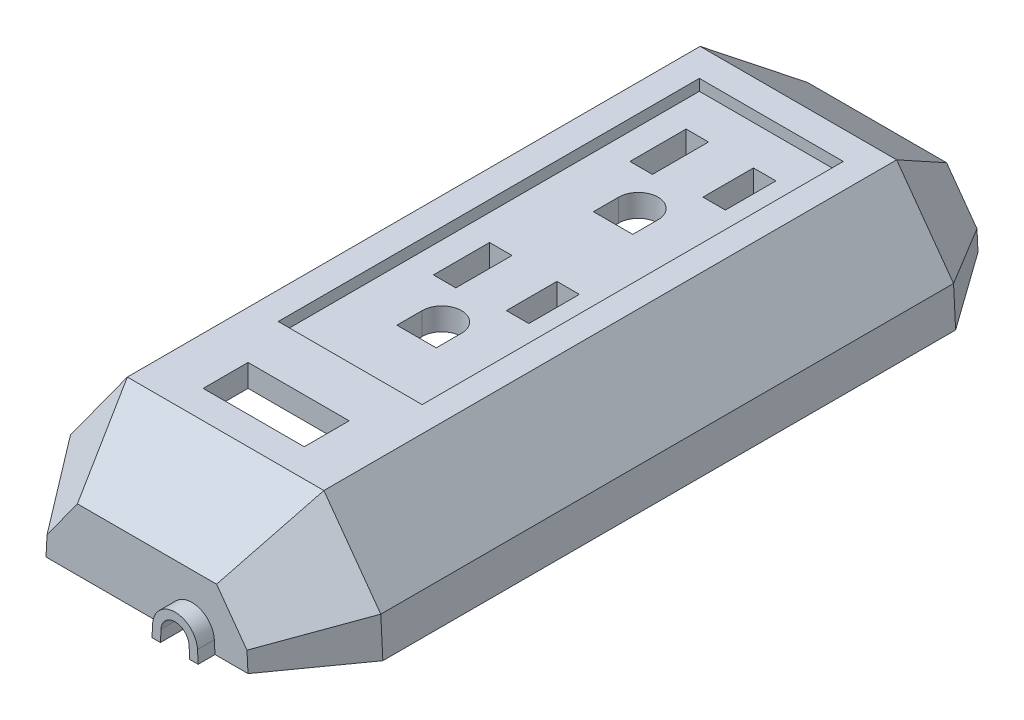
from build123d import *
from OCP.BRepFilletAPI import BRepFilletAPI_MakeChamfer

# Parameters (mm, degrees)
EXTRUDE1_DEPTH       = 130
CHAMFER1_SIZE        = 14
CHAMFER1_SIZE2       = 10
CHAMFER2_SIZE        = 10
CHAMFER2_SIZE2       = 14
EXTRUDE2_DEPTH       = 3
SKETCH3_W            = 25.633145545
SKETCH3_H            = 75
CUT_EXTRUDE1_DEPTH   = 11
SKETCH4_W            = 4
SKETCH4_H            = 9
SKETCH4_H_2          = 10
CUT_EXTRUDE2_DEPTH   = 15
LPATTERN1_COUNT      = 2
LPATTERN1_PITCH      = 35
SKETCH5_W            = 18
SKETCH5_H            = 8
CUT_EXTRUDE3_DEPTH   = 13
SHELL1_OUTLINE_W     = 28.633145545
SHELL1_OUTLINE_H     = 78
SHELL1_OUTLINE_W_2   = 21
SHELL1_OUTLINE_H_2   = 11
SHELL1_DEPTH         = 15
SHELL1_START         = 15
SHELL1_2_OUTLINE_W   = 28.633145545
SHELL1_2_OUTLINE_H   = 78
SHELL1_2_OUTLINE_W_2 = 7
SHELL1_2_OUTLINE_H_2 = 13
SHELL1_2_OUTLINE_H_3 = 12
SHELL1_2_DEPTH       = 2.5
SHELL1_3_OUTLINE_W   = 21
SHELL1_3_OUTLINE_H   = 11
SHELL1_3_DEPTH       = 2
SHELL1_START_2       = 14.48069758
SHELL1_4_DEPTH       = 101.03860484
SHELL1_START_3       = 95.5
SHELL1_5_DEPTH       = 6
SHELL1_START_4       = 101.5
SHELL1_6_OUTLINE_W   = 3.633145545
SHELL1_6_OUTLINE_H   = 19.5
SHELL1_6_DEPTH       = 14.01930242
SHELL1_7_DEPTH       = 3.01930242
SHELL1_START_5       = 112.5
SHELL1_8_DEPTH       = 3.01930242
SHELL1_START_6       = 1.5
SHELL1_9_DEPTH       = 131.5


with BuildPart() as part:
    # Sketch1 → Extrude1 (new body)
    with BuildSketch(Plane.XY):
        Polygon((17.5, 21), (27.633145545, 7), (28, 0), (-28, 0), (-27.633145545, 7), (-17.5, 21), align=None)
    extrude(amount=EXTRUDE1_DEPTH)

    # Chamfer1: one chamfer whose edges measure the first distance from different faces: ONE call of the kernel's chamfer builder (chamfer() names one face for all edges)
    chamfer1_edges_1 = [part.edges().sort_by_distance(p)[0] for p in [
        (0, 21, 130),
    ]]
    chamfer1_side_1 = [part.faces().sort_by_distance(p)[0] for p in [
        (0, 21, 65),
    ]]
    chamfer1_edges_2 = [part.edges().sort_by_distance(p)[0] for p in [
        (-22.566572773, 14, 130),
    ]]
    chamfer1_side_2 = [part.faces().sort_by_distance(p)[0] for p in [
        (-22.566572773, 14, 65),
    ]]
    chamfer1_edges_3 = [part.edges().sort_by_distance(p)[0] for p in [
        (-27.816572773, 3.5, 130),
    ]]
    chamfer1_side_3 = [part.faces().sort_by_distance(p)[0] for p in [
        (-27.816572773, 3.5, 65),
    ]]
    chamfer1_edges_4 = [part.edges().sort_by_distance(p)[0] for p in [
        (27.816572773, 3.5, 130),
    ]]
    chamfer1_side_4 = [part.faces().sort_by_distance(p)[0] for p in [
        (27.816572773, 3.5, 65),
    ]]
    chamfer1_edges_5 = [part.edges().sort_by_distance(p)[0] for p in [
        (22.566572773, 14, 130),
    ]]
    chamfer1_side_5 = [part.faces().sort_by_distance(p)[0] for p in [
        (22.566572773, 14, 65),
    ]]
    chamfer1 = BRepFilletAPI_MakeChamfer(part.part.solid().wrapped)
    for e in chamfer1_edges_1:
        chamfer1.Add(CHAMFER1_SIZE, CHAMFER1_SIZE2, e.wrapped, chamfer1_side_1[0].wrapped)  # the first distance lies on this face
    for e in chamfer1_edges_2:
        chamfer1.Add(CHAMFER1_SIZE, CHAMFER1_SIZE2, e.wrapped, chamfer1_side_2[0].wrapped)  # the first distance lies on this face
    for e in chamfer1_edges_3:
        chamfer1.Add(CHAMFER1_SIZE, CHAMFER1_SIZE2, e.wrapped, chamfer1_side_3[0].wrapped)  # the first distance lies on this face
    for e in chamfer1_edges_4:
        chamfer1.Add(CHAMFER1_SIZE, CHAMFER1_SIZE2, e.wrapped, chamfer1_side_4[0].wrapped)  # the first distance lies on this face
    for e in chamfer1_edges_5:
        chamfer1.Add(CHAMFER1_SIZE, CHAMFER1_SIZE2, e.wrapped, chamfer1_side_5[0].wrapped)  # the first distance lies on this face
    add(Compound.cast(chamfer1.Shape()), mode=Mode.REPLACE)

    # Chamfer2
    chamfer2_edges = [part.edges().sort_by_distance(p)[0] for p in [
        (-27.816572773, 3.5, 0),
        (-22.566572773, 14, 0),
        (0, 21, 0),
        (22.566572773, 14, 0),
        (27.816572773, 3.5, 0),
    ]]
    chamfer2_side = [part.faces().sort_by_distance(p)[0] for p in [
        (0, 9.6691811, 0),
    ]]
    chamfer(chamfer2_edges, length=CHAMFER2_SIZE, length2=CHAMFER2_SIZE2, reference=chamfer2_side[0])

    # Sketch2 → Extrude2 (add)
    with BuildSketch(Plane(origin=(5.745184329, -1.894827458, 130), x_dir=(1, 0, 0), z_dir=(0, 0, 1))):
        with BuildLine():
            Line((-1.855489271, 1.894827458), (6.365120614, 1.894827458))
            Line((6.365120614, 1.894827458), (6.24933381, 4.104171283))
            ThreePointArc((6.24933381, 4.104171283), (2.254815671, 7.894827458), (-1.739702468, 4.104171283))
            Line((-1.739702468, 4.104171283), (-1.855489271, 1.894827458))
        make_face()
    extrude(amount=EXTRUDE2_DEPTH)

    # Sketch3 → Cut-Extrude1 (cut)
    with BuildSketch(Plane(origin=(3.492514123, 30, 107.578199621), x_dir=(1, 0, 0), z_dir=(0, 1, 0))):
        with Locations((-3.309086896, 51.078199621)):
            Rectangle(SKETCH3_W, SKETCH3_H)
    extrude(amount=-CUT_EXTRUDE1_DEPTH, mode=Mode.SUBTRACT)

    # Sketch4 → Cut-Extrude2 (cut)
    with BuildSketch(Plane(origin=(-3.08260661, 30, 40.468913064), x_dir=(-1, 0, 0), z_dir=(0, 1, 0))):
        with Locations((-9.08260661, -9.968913064)):
            Rectangle(SKETCH4_W, SKETCH4_H)
        with Locations((2.91739339, -9.468913064)):
            Rectangle(SKETCH4_W, SKETCH4_H_2)
        with BuildLine():
            Line((-6.58260661, 6.531086936), (-6.58260661, 2.031086936))
            ThreePointArc((-6.58260661, 2.031086936), (-3.08260661, -1.468913064), (0.41739339, 2.031086936))
            Line((0.41739339, 2.031086936), (0.41739339, 6.531086936))
            Line((0.41739339, 6.531086936), (-6.58260661, 6.531086936))
        make_face()
    cut_extrude2 = extrude(amount=-CUT_EXTRUDE2_DEPTH, mode=Mode.SUBTRACT)

    # LPattern1: Cut-Extrude2 ×2
    with Locations(*[(0, 0, i * LPATTERN1_PITCH) for i in range(1, LPATTERN1_COUNT)]):
        add(cut_extrude2, mode=Mode.SUBTRACT)

    # Sketch5 → Cut-Extrude3 (cut)
    with BuildSketch(Plane(origin=(0.792567218, 30, 213.513140982), x_dir=(1, 0, 0), z_dir=(0, 1, 0))):
        with Locations((-0.792567218, 106.513140982)):
            Rectangle(SKETCH5_W, SKETCH5_H)
    extrude(amount=-CUT_EXTRUDE3_DEPTH, mode=Mode.SUBTRACT)

    # Shell1: read off the stored shape, not the designer's step
    # Shell1 outline → Shell1 (cut)
    with BuildSketch(Plane(origin=(0, 0, 0), x_dir=(1, 0, 0), z_dir=(0, 1, 0))):
        with Locations((0.183427228, -56.5)):
            Rectangle(SHELL1_OUTLINE_W, SHELL1_OUTLINE_H)
        with Locations((0, -107)):
            Rectangle(SHELL1_OUTLINE_W_2, SHELL1_OUTLINE_H_2)
    extrude(amount=SHELL1_DEPTH, mode=Mode.SUBTRACT)

    # Shell1 2 outline → Shell1 2 (cut)
    with BuildSketch(Plane(origin=(0, 0, 0), x_dir=(1, 0, 0), z_dir=(0, 1, 0)).offset(SHELL1_START)):
        with Locations((0.183427228, -56.5)):
            Rectangle(SHELL1_2_OUTLINE_W, SHELL1_2_OUTLINE_H)
        with BuildLine():
            Line((-5, -83.5), (-5, -77.5))
            ThreePointArc((-5, -77.5), (0, -72.5), (5, -77.5))
            Line((5, -77.5), (5, -83.5))
            Line((5, -83.5), (-5, -83.5))
        make_face(mode=Mode.SUBTRACT)
        with Locations((-6, -66)):
            Rectangle(SHELL1_2_OUTLINE_W_2, SHELL1_2_OUTLINE_H_2, mode=Mode.SUBTRACT)
        with Locations((6, -65.5)):
            Rectangle(SHELL1_2_OUTLINE_W_2, SHELL1_2_OUTLINE_H_3, mode=Mode.SUBTRACT)
        with BuildLine():
            Line((-5, -48.5), (-5, -42.5))
            ThreePointArc((-5, -42.5), (0, -37.5), (5, -42.5))
            Line((5, -42.5), (5, -48.5))
            Line((5, -48.5), (-5, -48.5))
        make_face(mode=Mode.SUBTRACT)
        with Locations((-6, -31)):
            Rectangle(SHELL1_2_OUTLINE_W_2, SHELL1_2_OUTLINE_H_2, mode=Mode.SUBTRACT)
        with Locations((6, -30.5)):
            Rectangle(SHELL1_2_OUTLINE_W_2, SHELL1_2_OUTLINE_H_3, mode=Mode.SUBTRACT)
    extrude(amount=SHELL1_2_DEPTH, mode=Mode.SUBTRACT)

    # Shell1 3 outline → Shell1 3 (cut)
    with BuildSketch(Plane(origin=(0, 0, 0), x_dir=(1, 0, 0), z_dir=(0, 1, 0)).offset(SHELL1_START)):
        with Locations((0, -107)):
            Rectangle(SHELL1_3_OUTLINE_W, SHELL1_3_OUTLINE_H)
    extrude(amount=SHELL1_3_DEPTH, mode=Mode.SUBTRACT)

    # Shell1 4 outline → Shell1 4 (cut)
    with BuildSketch(Plane.XY.offset(SHELL1_START_2)):
        Polygon((26.497941481, 0), (26.158378339, 6.479250719), (16.734010656, 19.5), (14.5, 19.5), (14.5, 0), align=None)
        with BuildLine():
            Line((10.608246424, 0), (10.496573837, 2.130839891))
            ThreePointArc((10.496573837, 2.130839891), (8, 4.5), (5.503426163, 2.130839891))
            Line((5.503426163, 2.130839891), (5.391753576, 0))
            Line((5.391753576, 0), (10.608246424, 0))
        make_face()
        Polygon((-14.133145545, 0), (-14.133145545, 19.5), (-16.734010656, 19.5), (-26.158378339, 6.479250719), (-26.497941481, 0), align=None)
    extrude(amount=SHELL1_4_DEPTH, mode=Mode.SUBTRACT)

    # Shell1 5 outline → Shell1 5 (cut)
    with BuildSketch(Plane.XY.offset(SHELL1_START_3)):
        with BuildLine():
            Line((10.608246424, 0), (14.5, 0))
            Line((14.5, 0), (14.5, 19.5))
            Line((14.5, 19.5), (-14.133145545, 19.5))
            Line((-14.133145545, 19.5), (-14.133145545, 0))
            Line((-14.133145545, 0), (5.391753576, 0))
            Line((5.391753576, 0), (5.503426163, 2.130839891))
            ThreePointArc((5.503426163, 2.130839891), (8, 4.5), (10.496573837, 2.130839891))
            Line((10.496573837, 2.130839891), (10.608246424, 0))
        make_face()
    extrude(amount=SHELL1_5_DEPTH, mode=Mode.SUBTRACT)

    # Shell1 6 outline → Shell1 6 (cut)
    with BuildSketch(Plane.XY.offset(SHELL1_START_4)):
        Polygon((10.608246424, 0), (14.5, 0), (14.5, 19.5), (10.5, 19.5), (10.5, 2.065464807), align=None)
        with Locations((-12.316572773, 9.75)):
            Rectangle(SHELL1_6_OUTLINE_W, SHELL1_6_OUTLINE_H)
    extrude(amount=SHELL1_6_DEPTH, mode=Mode.SUBTRACT)

    # Shell1 7 outline → Shell1 7 (cut)
    with BuildSketch(Plane.XY.offset(SHELL1_START_2)):
        with BuildLine():
            Line((10.608246424, 0), (14.5, 0))
            Line((14.5, 0), (14.5, 19.5))
            Line((14.5, 19.5), (-14.133145545, 19.5))
            Line((-14.133145545, 19.5), (-14.133145545, 0))
            Line((-14.133145545, 0), (5.391753576, 0))
            Line((5.391753576, 0), (5.503426163, 2.130839891))
            ThreePointArc((5.503426163, 2.130839891), (8, 4.5), (10.496573837, 2.130839891))
            Line((10.496573837, 2.130839891), (10.608246424, 0))
        make_face()
    extrude(amount=SHELL1_7_DEPTH, mode=Mode.SUBTRACT)

    # Shell1 8 outline → Shell1 8 (cut)
    with BuildSketch(Plane.XY.offset(SHELL1_START_5)):
        with BuildLine():
            Line((10.5, 2.065464807), (10.5, 19.5))
            Line((10.5, 19.5), (-10.5, 19.5))
            Line((-10.5, 19.5), (-10.5, 0))
            Line((-10.5, 0), (5.391753576, 0))
            Line((5.391753576, 0), (5.503426163, 2.130839891))
            ThreePointArc((5.503426163, 2.130839891), (8, 4.5), (10.496573837, 2.130839891))
            Line((10.496573837, 2.130839891), (10.5, 2.065464807))
        make_face()
    extrude(amount=SHELL1_8_DEPTH, mode=Mode.SUBTRACT)

    # Shell1 9 outline → Shell1 9 (cut)
    with BuildSketch(Plane.XY.offset(SHELL1_START_6)):
        with BuildLine():
            Line((10.608246424, 0), (10.496573837, 2.130839891))
            ThreePointArc((10.496573837, 2.130839891), (8, 4.5), (5.503426163, 2.130839891))
            Line((5.503426163, 2.130839891), (5.391753576, 0))
            Line((5.391753576, 0), (10.608246424, 0))
        make_face()
    extrude(amount=SHELL1_9_DEPTH, mode=Mode.SUBTRACT)

    # Shell1 10: loft between two sections, ruled curve by curve
    shell1_10_from = [
        Edge.make_line((-26.497941481, 0, 115.51930242), (-26.158378339, 6.479250719, 115.51930242)),
        Edge.make_line((-26.158378339, 6.479250719, 115.51930242), (-16.734010656, 19.5, 115.51930242)),
        Edge.make_line((-16.734010656, 19.5, 115.51930242), (16.734010656, 19.5, 115.51930242)),
        Edge.make_line((16.734010656, 19.5, 115.51930242), (26.158378339, 6.479250719, 115.51930242)),
        Edge.make_line((26.497941481, 0, 115.51930242), (26.158378339, 6.479250719, 115.51930242)),
        Edge.make_line((26.497941481, 0, 115.51930242), (-26.497941481, 0, 115.51930242)),
    ]
    shell1_10_to = [
        Edge.make_line((-17.213290346, 0, 128.5), (-17.042422579, 3.260351225, 128.5)),
        Edge.make_line((-17.042422579, 3.260351225, 128.5), (-11.999212546, 10.228073157, 128.5)),
        Edge.make_line((-11.999212546, 10.228073157, 128.5), (11.999212546, 10.228073157, 128.5)),
        Edge.make_line((11.999212546, 10.228073157, 128.5), (17.042422579, 3.260351225, 128.5)),
        Edge.make_line((17.213290346, 0, 128.5), (17.042422579, 3.260351225, 128.5)),
        Edge.make_line((17.213290346, 0, 128.5), (-17.213290346, 0, 128.5)),
    ]
    shell1_10 = Solid(Shell([*[Face.make_surface_from_curves(shell1_10_from[k], shell1_10_to[k]) for k in range(6)], Face(Wire(shell1_10_from)), Face(Wire(shell1_10_to))]))
    add(shell1_10, mode=Mode.SUBTRACT)

    # Shell1 11: loft between two sections, ruled curve by curve
    shell1_11_from = [
        Edge.make_line((17.213290346, 0, 1.5), (17.042422579, 3.260351225, 1.5)),
        Edge.make_line((17.042422579, 3.260351225, 1.5), (11.999212546, 10.228073157, 1.5)),
        Edge.make_line((11.999212546, 10.228073157, 1.5), (-11.999212546, 10.228073157, 1.5)),
        Edge.make_line((-11.999212546, 10.228073157, 1.5), (-17.042422579, 3.260351225, 1.5)),
        Edge.make_line((-17.042422579, 3.260351225, 1.5), (-17.213290346, 0, 1.5)),
        Edge.make_line((-17.213290346, 0, 1.5), (17.213290346, 0, 1.5)),
    ]
    shell1_11_to = [
        Edge.make_line((26.497941481, 0, 14.48069758), (26.158378339, 6.479250719, 14.48069758)),
        Edge.make_line((26.158378339, 6.479250719, 14.48069758), (16.734010656, 19.5, 14.48069758)),
        Edge.make_line((16.734010656, 19.5, 14.48069758), (-16.734010656, 19.5, 14.48069758)),
        Edge.make_line((-16.734010656, 19.5, 14.48069758), (-26.158378339, 6.479250719, 14.48069758)),
        Edge.make_line((-26.158378339, 6.479250719, 14.48069758), (-26.497941481, 0, 14.48069758)),
        Edge.make_line((-26.497941481, 0, 14.48069758), (26.497941481, 0, 14.48069758)),
    ]
    shell1_11 = Solid(Shell([*[Face.make_surface_from_curves(shell1_11_from[k], shell1_11_to[k]) for k in range(6)], Face(Wire(shell1_11_from)), Face(Wire(shell1_11_to))]))
    add(shell1_11, mode=Mode.SUBTRACT)


solid = part.part
